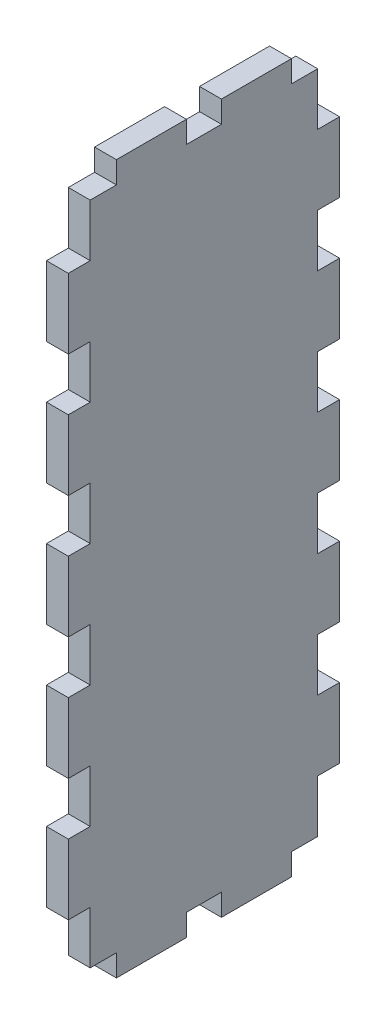
from build123d import *

# Parameters (mm, degrees)
SKETCH1_W               = 33.02
SKETCH1_H               = 96.52
BOSS_EXTRUDE1_DEPTH     = 3.175
SKETCH3_W               = 3.175
SKETCH3_H               = 10.16
BOSS_EXTRUDE2_DEPTH     = 3.175
LPATTERN1_COUNT         = 5
LPATTERN1_PITCH         = 17.78
MIRROR1_COPY_1_SKETCH_W = 3.175
MIRROR1_COPY_1_SKETCH_H = 10.16
MIRROR1_COPY_1_DEPTH    = 3.175
MIRROR1_COPY_2_SKETCH_W = 3.175
MIRROR1_COPY_2_SKETCH_H = 10.16
MIRROR1_COPY_2_DEPTH    = 3.175
MIRROR1_COPY_3_SKETCH_W = 3.175
MIRROR1_COPY_3_SKETCH_H = 10.16
MIRROR1_COPY_3_DEPTH    = 3.175
MIRROR1_COPY_4_SKETCH_W = 3.175
MIRROR1_COPY_4_SKETCH_H = 10.16
MIRROR1_COPY_4_DEPTH    = 3.175
MIRROR1_COPY_5_SKETCH_W = 3.175
MIRROR1_COPY_5_SKETCH_H = 10.16
MIRROR1_COPY_5_DEPTH    = 3.175
SKETCH4_W               = 3.175
SKETCH4_H               = 10.16
BOSS_EXTRUDE3_DEPTH     = 3.175
MIRROR3_COPY_1_SKETCH_W = 3.175
MIRROR3_COPY_1_SKETCH_H = 10.16
MIRROR3_COPY_1_DEPTH    = 3.175
MIRROR3_COPY_2_SKETCH_W = 3.175
MIRROR3_COPY_2_SKETCH_H = 10.16
MIRROR3_COPY_2_DEPTH    = 3.175


with BuildPart() as part:
    # Sketch1 → Boss-Extrude1 (new body)
    with BuildSketch(Plane(origin=(0, 0, 0), x_dir=(0, 0, -1), z_dir=(1, 0, 0))):
        with Locations((0.481407942, -2.352021661)):
            Rectangle(SKETCH1_W, SKETCH1_H)
    extrude(amount=BOSS_EXTRUDE1_DEPTH)

    # Sketch3 → Boss-Extrude2 (add)
    with BuildSketch(Plane.XY.offset(16.028592058)):
        with Locations((1.5875, 33.207978339)):
            Rectangle(SKETCH3_W, SKETCH3_H)
    boss_extrude2 = extrude(amount=BOSS_EXTRUDE2_DEPTH)

    # LPattern1: Boss-Extrude2 ×5
    with Locations(*[(0, -i * LPATTERN1_PITCH, 0) for i in range(1, LPATTERN1_COUNT)]):
        add(boss_extrude2)

    # Mirror1 copy 1 sketch → Mirror1 copy 1 (add)
    with BuildSketch(Plane(origin=(0, -17.78, -16.991407942), x_dir=(1, 0, 0), z_dir=(0, 0, -1))):
        with Locations((1.5875, -33.207978339)):
            Rectangle(MIRROR1_COPY_1_SKETCH_W, MIRROR1_COPY_1_SKETCH_H)
    extrude(amount=MIRROR1_COPY_1_DEPTH)

    # Mirror1 copy 2 sketch → Mirror1 copy 2 (add)
    with BuildSketch(Plane(origin=(0, -35.56, -16.991407942), x_dir=(1, 0, 0), z_dir=(0, 0, -1))):
        with Locations((1.5875, -33.207978339)):
            Rectangle(MIRROR1_COPY_2_SKETCH_W, MIRROR1_COPY_2_SKETCH_H)
    extrude(amount=MIRROR1_COPY_2_DEPTH)

    # Mirror1 copy 3 sketch → Mirror1 copy 3 (add)
    with BuildSketch(Plane(origin=(0, -53.34, -16.991407942), x_dir=(1, 0, 0), z_dir=(0, 0, -1))):
        with Locations((1.5875, -33.207978339)):
            Rectangle(MIRROR1_COPY_3_SKETCH_W, MIRROR1_COPY_3_SKETCH_H)
    extrude(amount=MIRROR1_COPY_3_DEPTH)

    # Mirror1 copy 4 sketch → Mirror1 copy 4 (add)
    with BuildSketch(Plane(origin=(0, -71.12, -16.991407942), x_dir=(1, 0, 0), z_dir=(0, 0, -1))):
        with Locations((1.5875, -33.207978339)):
            Rectangle(MIRROR1_COPY_4_SKETCH_W, MIRROR1_COPY_4_SKETCH_H)
    extrude(amount=MIRROR1_COPY_4_DEPTH)

    # Mirror1 copy 5 sketch → Mirror1 copy 5 (add)
    with BuildSketch(Plane(origin=(0, 0, -16.991407942), x_dir=(1, 0, 0), z_dir=(0, 0, -1))):
        with Locations((1.5875, -33.207978339)):
            Rectangle(MIRROR1_COPY_5_SKETCH_W, MIRROR1_COPY_5_SKETCH_H)
    extrude(amount=MIRROR1_COPY_5_DEPTH)

    # Sketch4 → Boss-Extrude3 (add)
    with BuildSketch(Plane(origin=(0, 45.907978339, 0), x_dir=(1, 0, 0), z_dir=(0, 1, 0))):
        with Locations((1.5875, -7.138592058)):
            Rectangle(SKETCH4_W, SKETCH4_H)
    boss_extrude3 = extrude(amount=BOSS_EXTRUDE3_DEPTH)

    # Mirror2: Boss-Extrude3 across plane
    add(boss_extrude3.mirror(Plane(origin=(0, 0, -0.481407942), x_dir=(1, 0, 0), z_dir=(0, 0, -1))))

    # Mirror3 copy 1 sketch → Mirror3 copy 1 (add)
    with BuildSketch(Plane(origin=(0, -50.612021661, -0.962815884), x_dir=(1, 0, 0), z_dir=(0, -1, 0))):
        with Locations((1.5875, -7.138592058)):
            Rectangle(MIRROR3_COPY_1_SKETCH_W, MIRROR3_COPY_1_SKETCH_H)
    extrude(amount=MIRROR3_COPY_1_DEPTH)

    # Mirror3 copy 2 sketch → Mirror3 copy 2 (add)
    with BuildSketch(Plane.XZ.offset(50.612021661)):
        with Locations((1.5875, 7.138592058)):
            Rectangle(MIRROR3_COPY_2_SKETCH_W, MIRROR3_COPY_2_SKETCH_H)
    extrude(amount=MIRROR3_COPY_2_DEPTH)


solid = part.part
